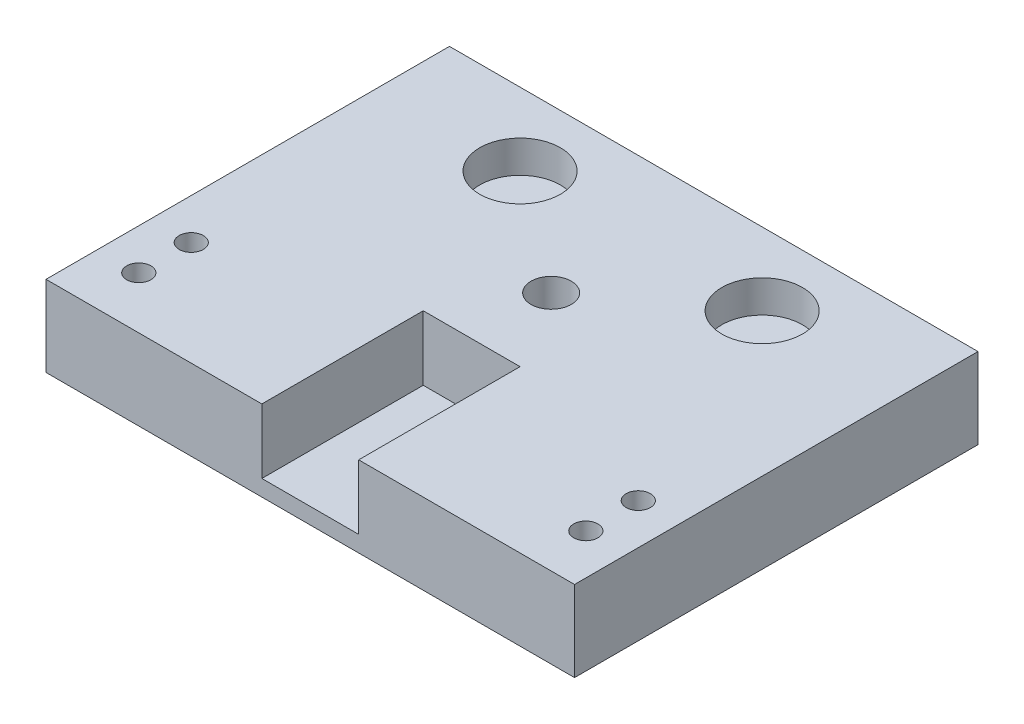
from build123d import *

# Parameters (mm, degrees)
BOSS_EXTRUDE1_DEPTH            = 20
F_3_2_3_2_DIAMETER_HOLE1_D     = 3.2
F_3_2_3_2_DIAMETER_HOLE1_DEPTH = 12
F_3_2_3_2_DIAMETER_HOLE1_TIP   = 0.96137699
SKETCH13_R                     = 1.5
CUT_EXTRUDE2_DEPTH             = 54
SKETCH15_W                     = 65.5
SKETCH15_H                     = 10
BOSS_EXTRUDE3_DEPTH            = 30
SKETCH16_R                     = 2.5
CUT_EXTRUDE4_DEPTH             = 10
SKETCH18_R                     = 5
CUT_EXTRUDE5_DEPTH             = 4
SKETCH19_R                     = 5
CUT_EXTRUDE6_DEPTH             = 4


with BuildPart() as part:
    # Sketch1 → Boss-Extrude1 (new body)
    with BuildSketch(Plane.XY):
        Polygon((26.75, 10), (26.75, 2), (38.75, 2), (38.75, 10), (65.5, 10), (65.5, 0), (0, 0), (0, 10), align=None)
    extrude(amount=BOSS_EXTRUDE1_DEPTH)

    # Ø3.2 (3.2) Diameter Hole1
    with Locations(Plane.XZ):
        with Locations((32.75, 10)):
            Hole(F_3_2_3_2_DIAMETER_HOLE1_D / 2, depth=F_3_2_3_2_DIAMETER_HOLE1_DEPTH)
            with Locations((0, 0, -(F_3_2_3_2_DIAMETER_HOLE1_DEPTH + F_3_2_3_2_DIAMETER_HOLE1_TIP / 2))):  # 118° drill point
                Cone(0, F_3_2_3_2_DIAMETER_HOLE1_D / 2, F_3_2_3_2_DIAMETER_HOLE1_TIP, mode=Mode.SUBTRACT)

    # Sketch13 → Cut-Extrude2 (cut)
    with BuildSketch(Plane.XZ):
        with Locations((5.05, 7.05)):
            Circle(SKETCH13_R)
        with Locations((5.05, 13.55)):
            Circle(SKETCH13_R)
        with Locations((60.45, 7.05)):
            Circle(SKETCH13_R)
        with Locations((60.45, 13.55)):
            Circle(SKETCH13_R)
    extrude(amount=-CUT_EXTRUDE2_DEPTH, mode=Mode.SUBTRACT)

    # Sketch15 → Boss-Extrude3 (add)
    with BuildSketch(Plane(origin=(0, 0, 0), x_dir=(-1, 0, 0), z_dir=(0, 0, -1))):
        with Locations((-32.75, 5)):
            Rectangle(SKETCH15_W, SKETCH15_H)
    extrude(amount=BOSS_EXTRUDE3_DEPTH)

    # Sketch16 → Cut-Extrude4 (cut)
    with BuildSketch(Plane(origin=(0, 10, 0), x_dir=(1, 0, 0), z_dir=(0, 1, 0))):
        with Locations((32.75, 9.85)):
            Circle(SKETCH16_R)
    extrude(amount=-CUT_EXTRUDE4_DEPTH, mode=Mode.SUBTRACT)

    # Sketch18 → Cut-Extrude5 (cut)
    with BuildSketch(Plane.XZ):
        with Locations((52.75, -9.85)):
            Circle(SKETCH18_R)
        with Locations((12.75, -9.85)):
            Circle(SKETCH18_R)
    extrude(amount=-CUT_EXTRUDE5_DEPTH, mode=Mode.SUBTRACT)

    # Sketch19 → Cut-Extrude6 (cut)
    with BuildSketch(Plane(origin=(0, 10, 0), x_dir=(1, 0, 0), z_dir=(0, 1, 0))):
        with Locations((47.75, 21)):
            Circle(SKETCH19_R)
        with Locations((17.75, 21)):
            Circle(SKETCH19_R)
    extrude(amount=-CUT_EXTRUDE6_DEPTH, mode=Mode.SUBTRACT)


solid = part.part
